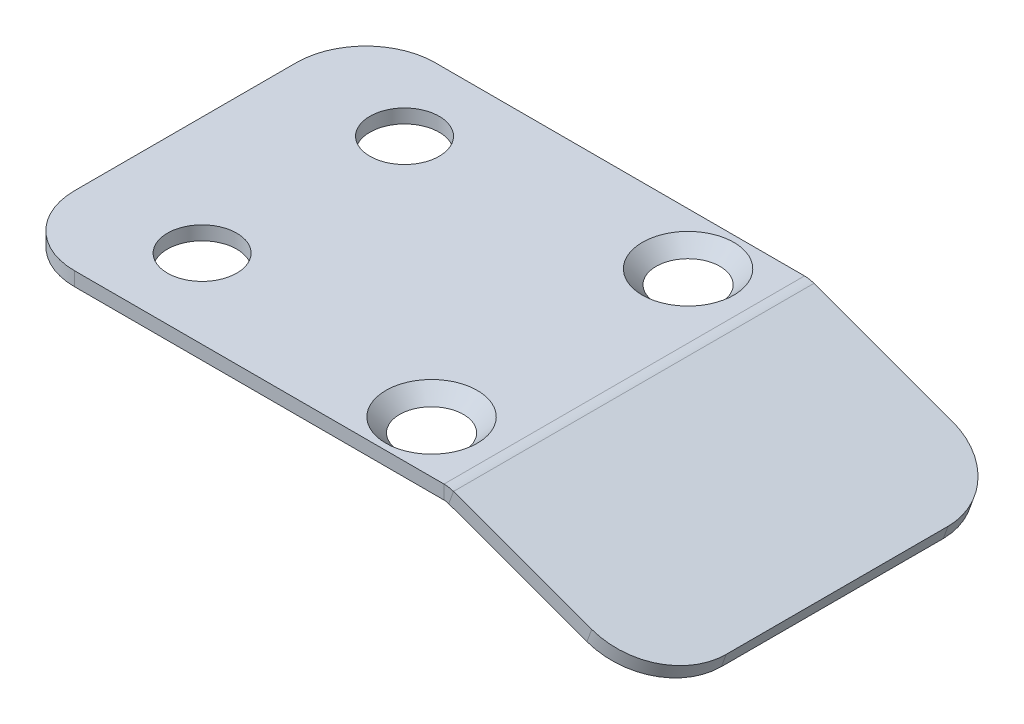
from build123d import *

# Parameters (mm, degrees)
SM_BASE_FLANGE_1_DEPTH   = 13
HOLE_WIZARD_1_AT_2_COUNT = 2
HOLE_WIZARD_1_AT_2_PITCH = 18.5
HOLE_WIZARD_5_0_5_1_D    = 5
FILLET_1_R               = 5


# Sheet-metal steps are written as plain solids
with BuildPart() as part:
    # Sketch 1 → 基体-法兰1 (new, symmetric)
    with BuildSketch(Plane.XY):
        with BuildLine():
            Line((-16, 0), (15.647346039, 0))
            ThreePointArc((15.647346039, 0), (15.994642394, -0.030384494), (16.331386325, -0.120614758))
            Line((16.331386325, -0.120614758), (31, -5.459553514))
            Line((31, -5.459553514), (30.657979857, -6.399246135))
            Line((30.657979857, -6.399246135), (15.989366182, -1.060307379))
            ThreePointArc((15.989366182, -1.060307379), (15.820994216, -1.015192247), (15.647346039, -1))
            Line((15.647346039, -1), (-16, -1))
            Line((-16, -1), (-16, 0))
        make_face()
    extrude(amount=SM_BASE_FLANGE_1_DEPTH, both=True)

    # 草图6 → 打孔尺寸(%根据十字)槽沉头木螺钉的类型1 (revolve, cut)
    with BuildSketch(Plane(origin=(11, 0, 9.25), x_dir=(0, 0, 1), z_dir=(1, 0, 0))):
        Polygon((0, 0), (0, 1), (1.7, 1), (1.7, 1.6), (3.3, 0), align=None)
    hole_wizard_1 = revolve(axis=Axis((11, 6.35, 9.25), (0, -1, 0)), mode=Mode.SUBTRACT)

    # 打孔尺寸(%根据十字)槽沉头木螺钉的类型1 at 2: 打孔尺寸(%根据十字)槽沉头木螺钉的类型1 ×2
    with Locations(*[(0, 0, -i * HOLE_WIZARD_1_AT_2_PITCH) for i in range(1, HOLE_WIZARD_1_AT_2_COUNT)]):
        add(hole_wizard_1, mode=Mode.SUBTRACT)

    # Ø5.0 (5) 直径孔1 (through all)
    with Locations(Plane(origin=(0, 0, 0), x_dir=(1, 0, 0), z_dir=(0, 1, 0))):
        with Locations((-7.5, -7.3), (-7.5, 7.3)):
            Hole(HOLE_WIZARD_5_0_5_1_D / 2)

    # 圆角1
    fillet_1_edges = [part.edges().sort_by_distance(p)[0] for p in [
        (-16, -0.5, 13),
        (30.828989928, -5.929399824, 13),
        (-16, -0.5, -13),
        (30.828989928, -5.929399824, -13),
    ]]
    fillet(fillet_1_edges, radius=FILLET_1_R)


solid = part.part
